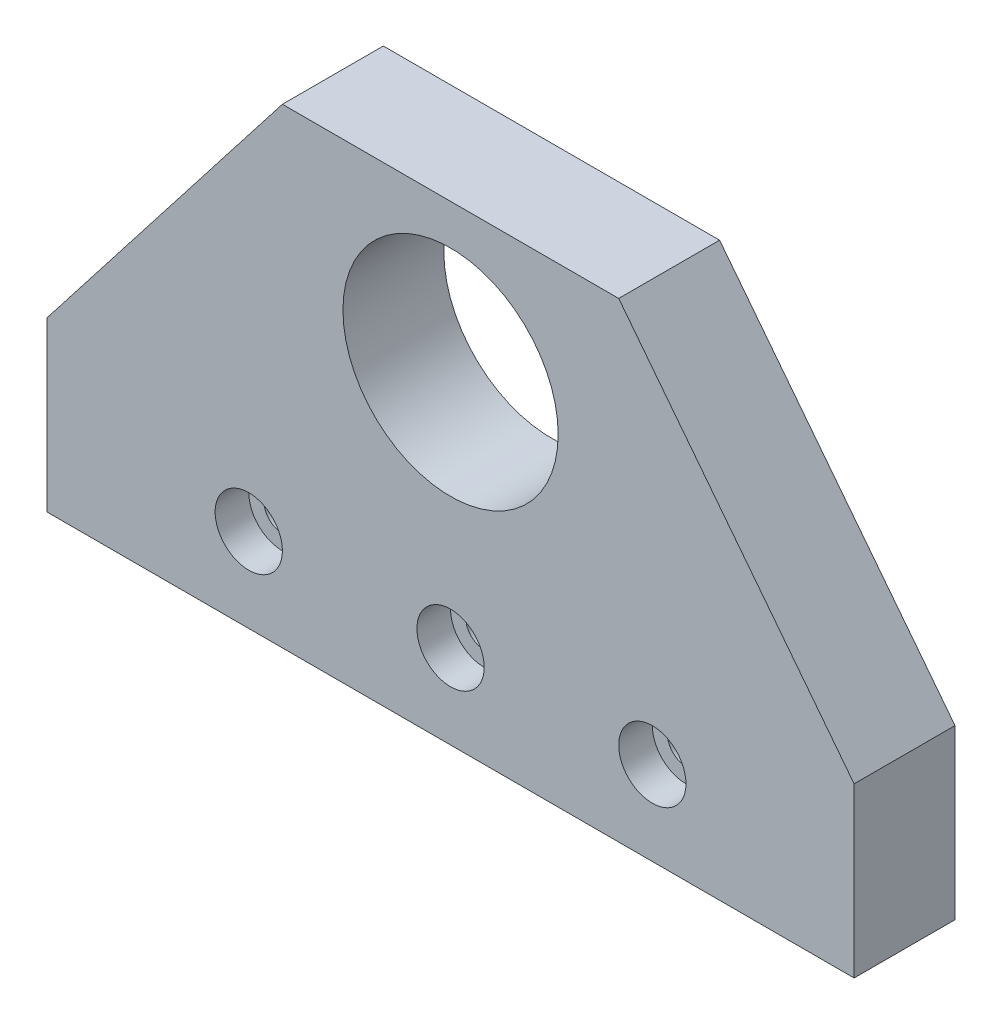
from build123d import *

# Parameters (mm, degrees)
BOSS_EXTRUDE1_DEPTH            = 15
CBORE_FOR_M5_SHCS1_D           = 5.5
CBORE_FOR_M5_SHCS1_CBORE_D     = 10
CBORE_FOR_M5_SHCS1_CBORE_DEPTH = 5
SKETCH4_R                      = 16
CUT_EXTRUDE1_DEPTH             = 94.407708461


with BuildPart() as part:
    # Sketch1 → Boss-Extrude1 (new body)
    with BuildSketch(Plane.XY):
        Polygon((60, 0), (-60, 0), (-60, 25), (-25, 70), (25, 70), (60, 25), align=None)
    extrude(amount=BOSS_EXTRUDE1_DEPTH)

    # CBORE for M5 SHCS1 (through all)
    with Locations(Plane(origin=(-30, 12.5, 15), x_dir=(1, 0, 0), z_dir=(0, 0, 1))):
        with Locations((0, 0), (30, 0), (60, 0)):
            CounterBoreHole(CBORE_FOR_M5_SHCS1_D / 2, CBORE_FOR_M5_SHCS1_CBORE_D / 2, CBORE_FOR_M5_SHCS1_CBORE_DEPTH)

    # Sketch4 → Cut-Extrude1 (cut, through all)
    with BuildSketch(Plane.XY.offset(15)):
        with Locations((0, 48)):
            Circle(SKETCH4_R)
    extrude(amount=-CUT_EXTRUDE1_DEPTH, mode=Mode.SUBTRACT)


solid = part.part
